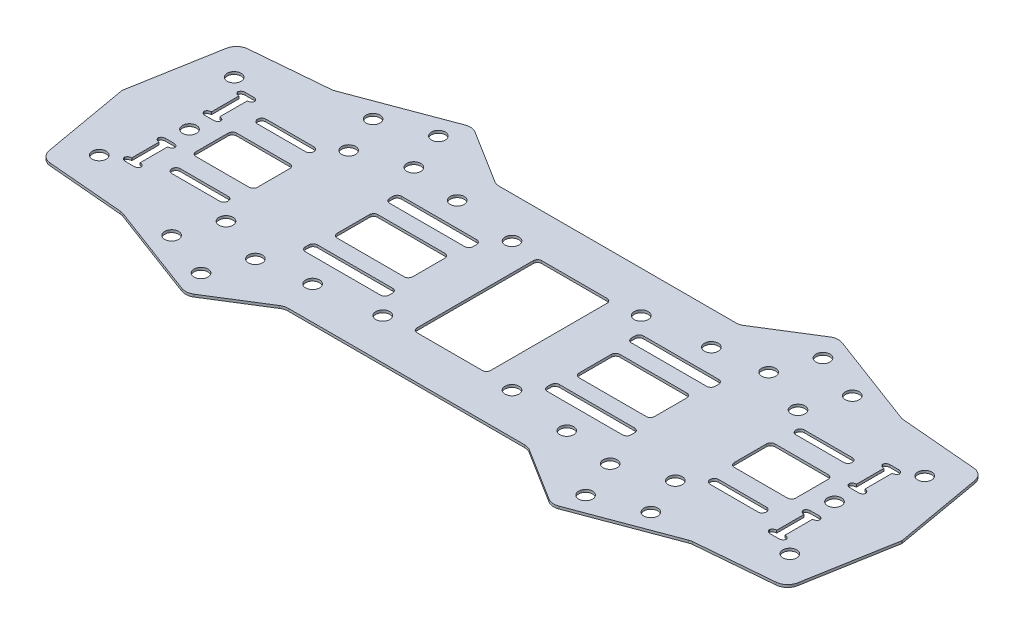
from build123d import *
from build123d.topology import SkipClean

# Parameters (mm, degrees)
BOSS_EXTRUDE1_DEPTH  = 0.6
CUT_EXTRUDE1_REACH   = 100.472
SKETCH2_R            = 1.65
CUT_EXTRUDE2_REACH   = 100.472
SKETCH3_W            = 8.75
SKETCH3_H            = 14.8
SKETCH3_W_2          = 17.9
SKETCH3_H_2          = 4.825
SKETCH3_W_3          = 14.6
SKETCH3_W_4          = 19.85
SKETCH3_H_3          = 2.85
SKETCH3_W_5          = 13.35
SKETCH3_H_4          = 2
FILLET1_R            = 1
FILLET1_OF_MIRROR1_R = 1
MIRROR2_OUTLINE_R    = 1.65
MIRROR2_DEPTH        = 0.6


# Read off the part's stored shape, not the designer's step: Mirror2
with BuildPart() as part:
    # Sketch1 → Boss-Extrude1 (new body)
    with BuildSketch(Plane(origin=(0, 0, 0), x_dir=(1, 0, 0), z_dir=(0, 1, 0))):
        with BuildLine():
            Line((0, 25.05), (-28.014357522, 25.05))
            ThreePointArc((-28.014357522, 25.05), (-28.841630476, 25.166318419), (-29.604752042, 25.506253694))
            Line((-29.604752042, 25.506253694), (-42.084431009, 33.308766465))
            ThreePointArc((-42.084431009, 33.308766465), (-43.375, 33.75), (-44.727541441, 33.574253009))
            Line((-44.727541441, 33.574253009), (-67.089543652, 25.194443715))
            ThreePointArc((-67.089543652, 25.194443715), (-67.481193837, 25.077417503), (-67.885116707, 25.014717291))
            Line((-67.885116707, 25.014717291), (-86.101034423, 23.447585491))
            ThreePointArc((-86.101034423, 23.447585491), (-87.868937695, 22.672037198), (-88.798256509, 20.979901364))
            Line((-88.798256509, 20.979901364), (-92.5, 0))
            Line((-92.5, 0), (0, 0))
            Line((0, 0), (0, 25.05))
        make_face()
    boss_extrude1 = extrude(amount=BOSS_EXTRUDE1_DEPTH)

    # Sketch2 → Cut-Extrude1 (cut, up to next)
    with BuildSketch(Plane(origin=(0, 0.6, 0), x_dir=(1, 0, 0), z_dir=(0, 1, 0)), mode=Mode.PRIVATE) as cut_extrude1_sk1:
        with Locations(Location((-15.325, 15.325, 0), (0, 0, 270))):
            Circle(SKETCH2_R)
    cut_extrude1_tool1 = extrude(cut_extrude1_sk1.sketch, amount=-CUT_EXTRUDE1_REACH, mode=Mode.PRIVATE) & part.part
    # Sketch2 → Cut-Extrude1 (cut, up to next)
    with BuildSketch(Plane(origin=(0, 0.6, 0), x_dir=(1, 0, 0), z_dir=(0, 1, 0)), mode=Mode.PRIVATE) as cut_extrude1_sk2:
        with Locations(Location((-30.15, 17.15, 0), (0, 0, 270))):
            Circle(SKETCH2_R)
    cut_extrude1_tool2 = extrude(cut_extrude1_sk2.sketch, amount=-CUT_EXTRUDE1_REACH, mode=Mode.PRIVATE) & part.part
    # Sketch2 → Cut-Extrude1 (cut, up to next)
    with BuildSketch(Plane(origin=(0, 0.6, 0), x_dir=(1, 0, 0), z_dir=(0, 1, 0)), mode=Mode.PRIVATE) as cut_extrude1_sk3:
        with Locations(Location((-42.075, 18.8, 0), (0, 0, 270))):
            Circle(SKETCH2_R)
    cut_extrude1_tool3 = extrude(cut_extrude1_sk3.sketch, amount=-CUT_EXTRUDE1_REACH, mode=Mode.PRIVATE) & part.part
    # Sketch2 → Cut-Extrude1 (cut, up to next)
    with BuildSketch(Plane(origin=(0, 0.6, 0), x_dir=(1, 0, 0), z_dir=(0, 1, 0)), mode=Mode.PRIVATE) as cut_extrude1_sk4:
        with Locations(Location((-45.616666667, 28.151823203, 0), (0, 0, 270))):
            Circle(SKETCH2_R)
    cut_extrude1_tool4 = extrude(cut_extrude1_sk4.sketch, amount=-CUT_EXTRUDE1_REACH, mode=Mode.PRIVATE) & part.part
    # Sketch2 → Cut-Extrude1 (cut, up to next)
    with BuildSketch(Plane(origin=(0, 0.6, 0), x_dir=(1, 0, 0), z_dir=(0, 1, 0)), mode=Mode.PRIVATE) as cut_extrude1_sk5:
        with Locations(Location((-53.297187844, 14.55, 0), (0, 0, 270))):
            Circle(SKETCH2_R)
    cut_extrude1_tool5 = extrude(cut_extrude1_sk5.sketch, amount=-CUT_EXTRUDE1_REACH, mode=Mode.PRIVATE) & part.part
    # Sketch2 → Cut-Extrude1 (cut, up to next)
    with BuildSketch(Plane(origin=(0, 0.6, 0), x_dir=(1, 0, 0), z_dir=(0, 1, 0)), mode=Mode.PRIVATE) as cut_extrude1_sk6:
        with Locations(Location((-56.83885451, 23.901823203, 0), (0, 0, 270))):
            Circle(SKETCH2_R)
    cut_extrude1_tool6 = extrude(cut_extrude1_sk6.sketch, amount=-CUT_EXTRUDE1_REACH, mode=Mode.PRIVATE) & part.part
    # Sketch2 → Cut-Extrude1 (cut, up to next)
    with BuildSketch(Plane(origin=(0, 0.6, 0), x_dir=(1, 0, 0), z_dir=(0, 1, 0)), mode=Mode.PRIVATE) as cut_extrude1_sk7:
        with Locations(Location((-81.910471472, 16, 0), (0, 0, 270))):
            Circle(SKETCH2_R)
    cut_extrude1_tool7 = extrude(cut_extrude1_sk7.sketch, amount=-CUT_EXTRUDE1_REACH, mode=Mode.PRIVATE) & part.part
    # Sketch2 → Cut-Extrude1 (cut, up to next)
    with BuildSketch(Plane(origin=(0, 0.6, 0), x_dir=(1, 0, 0), z_dir=(0, 1, 0)), mode=Mode.PRIVATE) as cut_extrude1_sk8:
        with Locations((-76.5, 0)):
            Circle(SKETCH2_R)
    cut_extrude1_tool8 = extrude(cut_extrude1_sk8.sketch, amount=-CUT_EXTRUDE1_REACH, mode=Mode.PRIVATE) & part.part
    cut_extrude1_1 = cut_extrude1_tool1.solids().sort_by_distance((-15.325, 0.6, -15.325))[0]
    add(cut_extrude1_1, mode=Mode.SUBTRACT)
    cut_extrude1_2 = cut_extrude1_tool2.solids().sort_by_distance((-30.15, 0.6, -17.15))[0]
    add(cut_extrude1_2, mode=Mode.SUBTRACT)
    cut_extrude1_3 = cut_extrude1_tool3.solids().sort_by_distance((-42.075, 0.6, -18.8))[0]
    add(cut_extrude1_3, mode=Mode.SUBTRACT)
    cut_extrude1_4 = cut_extrude1_tool4.solids().sort_by_distance((-45.616667, 0.6, -28.151823))[0]
    add(cut_extrude1_4, mode=Mode.SUBTRACT)
    cut_extrude1_5 = cut_extrude1_tool5.solids().sort_by_distance((-53.297188, 0.6, -14.55))[0]
    add(cut_extrude1_5, mode=Mode.SUBTRACT)
    cut_extrude1_6 = cut_extrude1_tool6.solids().sort_by_distance((-56.838855, 0.6, -23.901823))[0]
    add(cut_extrude1_6, mode=Mode.SUBTRACT)
    cut_extrude1_7 = cut_extrude1_tool7.solids().sort_by_distance((-81.910471, 0.6, -16))[0]
    add(cut_extrude1_7, mode=Mode.SUBTRACT)
    cut_extrude1_8 = cut_extrude1_tool8.solids().sort_by_distance((-76.5, 0.6, 0))[0]
    add(cut_extrude1_8, mode=Mode.SUBTRACT)
    cut_extrude1 = cut_extrude1_1 + cut_extrude1_2 + cut_extrude1_3 + cut_extrude1_4 + cut_extrude1_5 + cut_extrude1_6 + cut_extrude1_7 + cut_extrude1_8  # Cut-Extrude1 as one shape, for the pattern or mirror that repeats it

    # Sketch3 → Cut-Extrude2 (cut, up to next)
    with BuildSketch(Plane(origin=(0, 0.6, 0), x_dir=(1, 0, 0), z_dir=(0, 1, 0)), mode=Mode.PRIVATE) as cut_extrude2_sk1:
        with Locations((-4.375, 7.4)):
            Rectangle(SKETCH3_W, SKETCH3_H)
    cut_extrude2_tool1 = extrude(cut_extrude2_sk1.sketch, amount=-CUT_EXTRUDE2_REACH, mode=Mode.PRIVATE) & part.part
    # Sketch3 → Cut-Extrude2 (cut, up to next)
    with BuildSketch(Plane(origin=(0, 0.6, 0), x_dir=(1, 0, 0), z_dir=(0, 1, 0)), mode=Mode.PRIVATE) as cut_extrude2_sk2:
        with Locations((-28.7, 2.4125)):
            Rectangle(SKETCH3_W_2, SKETCH3_H_2)
    cut_extrude2_tool2 = extrude(cut_extrude2_sk2.sketch, amount=-CUT_EXTRUDE2_REACH, mode=Mode.PRIVATE) & part.part
    # Sketch3 → Cut-Extrude2 (cut, up to next)
    with BuildSketch(Plane(origin=(0, 0.6, 0), x_dir=(1, 0, 0), z_dir=(0, 1, 0)), mode=Mode.PRIVATE) as cut_extrude2_sk3:
        with Locations((-63.85, 2.4125)):
            Rectangle(SKETCH3_W_3, SKETCH3_H_2)
    cut_extrude2_tool3 = extrude(cut_extrude2_sk3.sketch, amount=-CUT_EXTRUDE2_REACH, mode=Mode.PRIVATE) & part.part
    # Sketch3 → Cut-Extrude2 (cut, up to next)
    with BuildSketch(Plane(origin=(0, 0.6, 0), x_dir=(1, 0, 0), z_dir=(0, 1, 0)), mode=Mode.PRIVATE) as cut_extrude2_sk4:
        with Locations((-28.7, 9.975)):
            Rectangle(SKETCH3_W_4, SKETCH3_H_3)
    cut_extrude2_tool4 = extrude(cut_extrude2_sk4.sketch, amount=-CUT_EXTRUDE2_REACH, mode=Mode.PRIVATE) & part.part
    # Sketch3 → Cut-Extrude2 (cut, up to next)
    with BuildSketch(Plane(origin=(0, 0.6, 0), x_dir=(1, 0, 0), z_dir=(0, 1, 0)), mode=Mode.PRIVATE) as cut_extrude2_sk5:
        with Locations((-63.85, 10.175)):
            Rectangle(SKETCH3_W_5, SKETCH3_H_4)
    cut_extrude2_tool5 = extrude(cut_extrude2_sk5.sketch, amount=-CUT_EXTRUDE2_REACH, mode=Mode.PRIVATE) & part.part
    # Sketch3 → Cut-Extrude2 (cut, up to next)
    with BuildSketch(Plane(origin=(0, 0.6, 0), x_dir=(1, 0, 0), z_dir=(0, 1, 0)), mode=Mode.PRIVATE) as cut_extrude2_sk6:
        Polygon((-78.55, 6.2), (-78.55, 4.7), (-74.45, 4.7), (-74.45, 6.2), (-75.5, 6.2), (-75.5, 12.7), (-74.45, 12.7), (-74.45, 14.2), (-78.55, 14.2), (-78.55, 12.7), (-77.5, 12.7), (-77.5, 6.2), align=None)
    cut_extrude2_tool6 = extrude(cut_extrude2_sk6.sketch, amount=-CUT_EXTRUDE2_REACH, mode=Mode.PRIVATE) & part.part
    cut_extrude2_1 = cut_extrude2_tool1.solids().sort_by_distance((-4.375, 0.6, -7.4))[0]
    add(cut_extrude2_1, mode=Mode.SUBTRACT)
    cut_extrude2_2 = cut_extrude2_tool2.solids().sort_by_distance((-28.7, 0.6, -2.4125))[0]
    add(cut_extrude2_2, mode=Mode.SUBTRACT)
    cut_extrude2_3 = cut_extrude2_tool3.solids().sort_by_distance((-63.85, 0.6, -2.4125))[0]
    add(cut_extrude2_3, mode=Mode.SUBTRACT)
    cut_extrude2_4 = cut_extrude2_tool4.solids().sort_by_distance((-28.7, 0.6, -9.975))[0]
    add(cut_extrude2_4, mode=Mode.SUBTRACT)
    cut_extrude2_5 = cut_extrude2_tool5.solids().sort_by_distance((-63.85, 0.6, -10.175))[0]
    add(cut_extrude2_5, mode=Mode.SUBTRACT)
    cut_extrude2_6 = cut_extrude2_tool6.solids().sort_by_distance((-76.5, 0.6, -9.45))[0]
    add(cut_extrude2_6, mode=Mode.SUBTRACT)
    cut_extrude2 = cut_extrude2_1 + cut_extrude2_2 + cut_extrude2_3 + cut_extrude2_4 + cut_extrude2_5 + cut_extrude2_6  # Cut-Extrude2 as one shape, for the pattern or mirror that repeats it

    # Fillet1
    # the kernel refuses this fillet: 1 mm, written as the material it adds along each edge
    with BuildSketch(Plane(origin=(-38.625, 0.6, -8.55), x_dir=(0, 0, -1), z_dir=(0, -1, 0)), Plane(origin=(-70.525, 0.6, -9.175), x_dir=(0, 0, -1), z_dir=(0, -1, 0)), Plane(origin=(-78.55, 0.6, -12.7), x_dir=(0, 0, -1), z_dir=(0, -1, 0)), Plane(origin=(-74.45, 0.6, -12.7), x_dir=(-1, 0, 0), z_dir=(0, -1, 0)), Plane(origin=(-57.175, 0.6, -9.175), x_dir=(-1, 0, 0), z_dir=(0, -1, 0)), Plane(origin=(-18.775, 0.6, -8.55), x_dir=(-1, 0, 0), z_dir=(0, -1, 0)), Plane(origin=(-8.75, 0.6, -14.8), x_dir=(1, 0, 0), z_dir=(0, -1, 0)), Plane(origin=(-37.65, 0.6, -4.825), x_dir=(1, 0, 0), z_dir=(0, -1, 0)), Plane(origin=(-19.75, 0.6, -4.825), x_dir=(0, 0, 1), z_dir=(0, -1, 0)), Plane(origin=(-18.775, 0.6, -11.4), x_dir=(0, 0, 1), z_dir=(0, -1, 0)), Plane(origin=(-56.55, 0.6, -4.825), x_dir=(0, 0, 1), z_dir=(0, -1, 0)), Plane(origin=(-57.175, 0.6, -11.175), x_dir=(0, 0, 1), z_dir=(0, -1, 0)), Plane(origin=(-74.45, 0.6, -14.2), x_dir=(0, 0, 1), z_dir=(0, -1, 0)), Plane(origin=(-78.55, 0.6, -14.2), x_dir=(1, 0, 0), z_dir=(0, -1, 0)), Plane(origin=(-71.15, 0.6, -4.825), x_dir=(1, 0, 0), z_dir=(0, -1, 0)), Plane(origin=(-74.45, 0.6, -4.7), x_dir=(-1, 0, 0), z_dir=(0, -1, 0)), Plane(origin=(-74.45, 0.6, -6.2), x_dir=(0, 0, 1), z_dir=(0, -1, 0)), Plane(origin=(-78.55, 0.6, -6.2), x_dir=(1, 0, 0), z_dir=(0, -1, 0))) as fillet1_piece_1:
        with BuildLine():
            CenterArc((FILLET1_R, FILLET1_R), FILLET1_R, 180, 90)
            Line((0, FILLET1_R), (0, 0))
            Line((0, 0), (FILLET1_R, 0))
        make_face()
    extrude(amount=0.6)
    with BuildSketch(Plane(origin=(-70.525, 0.6, -11.175), x_dir=(0, 0, 1), z_dir=(0, -1, 0)), Plane(origin=(-38.625, 0.6, -11.4), x_dir=(0, 0, 1), z_dir=(0, -1, 0)), Plane(origin=(-78.55, 0.6, -4.7), x_dir=(1, 0, 0), z_dir=(0, -1, 0))) as fillet1_piece_2:
        with BuildLine():
            CenterArc((FILLET1_R, -FILLET1_R), FILLET1_R, 90, 90)
            Line((0, -FILLET1_R), (0, 0))
            Line((0, 0), (FILLET1_R, 0))
        make_face()
    extrude(amount=0.6)

    # Mirror1: Boss-Extrude1, Cut-Extrude1, Cut-Extrude2 across plane
    add(boss_extrude1.mirror(Plane(origin=(0, 0, 0), x_dir=(0, 0, 1), z_dir=(1, 0, 0))))
    add(cut_extrude1.mirror(Plane(origin=(0, 0, 0), x_dir=(0, 0, 1), z_dir=(1, 0, 0))), mode=Mode.SUBTRACT)
    add(cut_extrude2.mirror(Plane(origin=(0, 0, 0), x_dir=(0, 0, 1), z_dir=(1, 0, 0))), mode=Mode.SUBTRACT)

    # Fillet1 of Mirror1
    # the kernel refuses this fillet: 1 mm, written as the material it adds along each edge
    with BuildSketch(Plane(origin=(38.625, 0.6, -8.55), x_dir=(-1, 0, 0), z_dir=(0, -1, 0)), Plane(origin=(70.525, 0.6, -9.175), x_dir=(-1, 0, 0), z_dir=(0, -1, 0)), Plane(origin=(78.55, 0.6, -12.7), x_dir=(-1, 0, 0), z_dir=(0, -1, 0)), Plane(origin=(74.45, 0.6, -12.7), x_dir=(0, 0, -1), z_dir=(0, -1, 0)), Plane(origin=(57.175, 0.6, -9.175), x_dir=(0, 0, -1), z_dir=(0, -1, 0)), Plane(origin=(18.775, 0.6, -8.55), x_dir=(0, 0, -1), z_dir=(0, -1, 0)), Plane(origin=(8.75, 0.6, -14.8), x_dir=(0, 0, 1), z_dir=(0, -1, 0)), Plane(origin=(37.65, 0.6, -4.825), x_dir=(0, 0, 1), z_dir=(0, -1, 0)), Plane(origin=(19.75, 0.6, -4.825), x_dir=(1, 0, 0), z_dir=(0, -1, 0)), Plane(origin=(56.55, 0.6, -4.825), x_dir=(1, 0, 0), z_dir=(0, -1, 0)), Plane(origin=(74.45, 0.6, -14.2), x_dir=(1, 0, 0), z_dir=(0, -1, 0)), Plane(origin=(78.55, 0.6, -14.2), x_dir=(0, 0, 1), z_dir=(0, -1, 0)), Plane(origin=(70.525, 0.6, -11.175), x_dir=(0, 0, 1), z_dir=(0, -1, 0)), Plane(origin=(38.625, 0.6, -11.4), x_dir=(0, 0, 1), z_dir=(0, -1, 0)), Plane(origin=(71.15, 0.6, -4.825), x_dir=(0, 0, 1), z_dir=(0, -1, 0)), Plane(origin=(74.45, 0.6, -4.7), x_dir=(0, 0, -1), z_dir=(0, -1, 0)), Plane(origin=(74.45, 0.6, -6.2), x_dir=(1, 0, 0), z_dir=(0, -1, 0)), Plane(origin=(78.55, 0.6, -4.7), x_dir=(-1, 0, 0), z_dir=(0, -1, 0))) as fillet1_of_mirror1_piece_1:
        with BuildLine():
            CenterArc((FILLET1_OF_MIRROR1_R, FILLET1_OF_MIRROR1_R), FILLET1_OF_MIRROR1_R, 180, 90)
            Line((0, FILLET1_OF_MIRROR1_R), (0, 0))
            Line((0, 0), (FILLET1_OF_MIRROR1_R, 0))
        make_face()
    extrude(amount=0.6)
    with BuildSketch(Plane(origin=(18.775, 0.6, -11.4), x_dir=(0, 0, 1), z_dir=(0, -1, 0)), Plane(origin=(57.175, 0.6, -11.175), x_dir=(0, 0, 1), z_dir=(0, -1, 0)), Plane(origin=(78.55, 0.6, -6.2), x_dir=(-1, 0, 0), z_dir=(0, -1, 0))) as fillet1_of_mirror1_piece_2:
        with BuildLine():
            CenterArc((FILLET1_OF_MIRROR1_R, -FILLET1_OF_MIRROR1_R), FILLET1_OF_MIRROR1_R, 90, 90)
            Line((0, -FILLET1_OF_MIRROR1_R), (0, 0))
            Line((0, 0), (FILLET1_OF_MIRROR1_R, 0))
        make_face()
    extrude(amount=0.6)

    # Mirror2 outline → Mirror2 (add)
    with SkipClean():  # the faces are left unmerged after this step: merging them gives an invalid solid
        with BuildSketch(Plane(origin=(0, 0, 0), x_dir=(1, 0, 0), z_dir=(0, 1, 0))):
            with BuildLine():
                Line((-71.15, 0), (-74.85, 0))
                ThreePointArc((-74.85, 0), (-76.5, -1.65), (-78.15, 0))
                Line((-78.15, 0), (-92.5, 0))
                Line((-92.5, 0), (-88.798256509, -20.979901364))
                ThreePointArc((-88.798256509, -20.979901364), (-87.868937695, -22.672037198), (-86.101034423, -23.447585491))
                Line((-86.101034423, -23.447585491), (-67.885116707, -25.014717291))
                ThreePointArc((-67.885116707, -25.014717291), (-67.481193837, -25.077417503), (-67.089543652, -25.194443715))
                Line((-67.089543652, -25.194443715), (-44.727541441, -33.574253009))
                ThreePointArc((-44.727541441, -33.574253009), (-43.375, -33.75), (-42.084431009, -33.308766465))
                Line((-42.084431009, -33.308766465), (-29.604752042, -25.506253694))
                ThreePointArc((-29.604752042, -25.506253694), (-28.841630476, -25.166318419), (-28.014357522, -25.05))
                Line((-28.014357522, -25.05), (28.014357522, -25.05))
                ThreePointArc((28.014357522, -25.05), (28.841630476, -25.166318419), (29.604752042, -25.506253694))
                Line((29.604752042, -25.506253694), (42.084431009, -33.308766465))
                ThreePointArc((42.084431009, -33.308766465), (43.375, -33.75), (44.727541441, -33.574253009))
                Line((44.727541441, -33.574253009), (67.089543652, -25.194443715))
                ThreePointArc((67.089543652, -25.194443715), (67.481193837, -25.077417503), (67.885116707, -25.014717291))
                Line((67.885116707, -25.014717291), (86.101034423, -23.447585491))
                ThreePointArc((86.101034423, -23.447585491), (87.868937695, -22.672037198), (88.798256509, -20.979901364))
                Line((88.798256509, -20.979901364), (92.5, 0))
                Line((92.5, 0), (78.15, 0))
                ThreePointArc((78.15, 0), (76.5, -1.65), (74.85, 0))
                Line((74.85, 0), (71.15, 0))
                Line((71.15, 0), (71.15, -3.825))
                ThreePointArc((71.15, -3.825), (70.857106781, -4.532106781), (70.15, -4.825))
                Line((70.15, -4.825), (57.55, -4.825))
                ThreePointArc((57.55, -4.825), (56.842893219, -4.532106781), (56.55, -3.825))
                Line((56.55, -3.825), (56.55, 0))
                Line((56.55, 0), (37.65, 0))
                Line((37.65, 0), (37.65, -3.825))
                ThreePointArc((37.65, -3.825), (37.357106781, -4.532106781), (36.65, -4.825))
                Line((36.65, -4.825), (20.75, -4.825))
                ThreePointArc((20.75, -4.825), (20.042893219, -4.532106781), (19.75, -3.825))
                Line((19.75, -3.825), (19.75, 0))
                Line((19.75, 0), (8.75, 0))
                Line((8.75, 0), (8.75, -13.8))
                ThreePointArc((8.75, -13.8), (8.457106781, -14.507106781), (7.75, -14.8))
                Line((7.75, -14.8), (-7.75, -14.8))
                ThreePointArc((-7.75, -14.8), (-8.457106781, -14.507106781), (-8.75, -13.8))
                Line((-8.75, -13.8), (-8.75, 0))
                Line((-8.75, 0), (-19.75, 0))
                Line((-19.75, 0), (-19.75, -3.825))
                ThreePointArc((-19.75, -3.825), (-20.042893219, -4.532106781), (-20.75, -4.825))
                Line((-20.75, -4.825), (-36.65, -4.825))
                ThreePointArc((-36.65, -4.825), (-37.357106781, -4.532106781), (-37.65, -3.825))
                Line((-37.65, -3.825), (-37.65, 0))
                Line((-37.65, 0), (-56.55, 0))
                Line((-56.55, 0), (-56.55, -3.825))
                ThreePointArc((-56.55, -3.825), (-56.842893219, -4.532106781), (-57.55, -4.825))
                Line((-57.55, -4.825), (-70.15, -4.825))
                ThreePointArc((-70.15, -4.825), (-70.857106781, -4.532106781), (-71.15, -3.825))
                Line((-71.15, -3.825), (-71.15, 0))
            make_face()
            with Locations((-45.616666667, -28.151823203)):
                Circle(MIRROR2_OUTLINE_R, mode=Mode.SUBTRACT)
            with Locations((-56.83885451, -23.901823203)):
                Circle(MIRROR2_OUTLINE_R, mode=Mode.SUBTRACT)
            with Locations((-42.075, -18.8)):
                Circle(MIRROR2_OUTLINE_R, mode=Mode.SUBTRACT)
            with Locations((-30.15, -17.15)):
                Circle(MIRROR2_OUTLINE_R, mode=Mode.SUBTRACT)
            with Locations((45.616666667, -28.151823203)):
                Circle(MIRROR2_OUTLINE_R, mode=Mode.SUBTRACT)
            with Locations((42.075, -18.8)):
                Circle(MIRROR2_OUTLINE_R, mode=Mode.SUBTRACT)
            with Locations((30.15, -17.15)):
                Circle(MIRROR2_OUTLINE_R, mode=Mode.SUBTRACT)
            with Locations((56.83885451, -23.901823203)):
                Circle(MIRROR2_OUTLINE_R, mode=Mode.SUBTRACT)
            with Locations((-81.910471472, -16)):
                Circle(MIRROR2_OUTLINE_R, mode=Mode.SUBTRACT)
            with Locations((-53.297187844, -14.55)):
                Circle(MIRROR2_OUTLINE_R, mode=Mode.SUBTRACT)
            with BuildLine():
                Line((-77.5, -12.7), (-77.5, -6.2))
                Line((-77.5, -6.2), (-77.55, -6.2))
                ThreePointArc((-77.55, -6.2), (-78.162372436, -5.990569415), (-78.518245837, -5.45))
                ThreePointArc((-78.518245837, -5.45), (-78.162372436, -4.909430585), (-77.55, -4.7))
                Line((-77.55, -4.7), (-75.45, -4.7))
                ThreePointArc((-75.45, -4.7), (-74.837627564, -4.909430585), (-74.481754163, -5.45))
                ThreePointArc((-74.481754163, -5.45), (-74.837627564, -5.990569415), (-75.45, -6.2))
                Line((-75.45, -6.2), (-75.5, -6.2))
                Line((-75.5, -6.2), (-75.5, -12.7))
                Line((-75.5, -12.7), (-75.45, -12.7))
                ThreePointArc((-75.45, -12.7), (-74.837627564, -12.909430585), (-74.481754163, -13.45))
                ThreePointArc((-74.481754163, -13.45), (-74.837627564, -13.990569415), (-75.45, -14.2))
                Line((-75.45, -14.2), (-77.55, -14.2))
                ThreePointArc((-77.55, -14.2), (-78.162372436, -13.990569415), (-78.518245837, -13.45))
                ThreePointArc((-78.518245837, -13.45), (-78.162372436, -12.909430585), (-77.55, -12.7))
                Line((-77.55, -12.7), (-77.5, -12.7))
            make_face(mode=Mode.SUBTRACT)
            with BuildLine():
                ThreePointArc((-70.525, -10.175), (-70.232106781, -9.467893219), (-69.525, -9.175))
                Line((-69.525, -9.175), (-58.175, -9.175))
                ThreePointArc((-58.175, -9.175), (-57.467893219, -9.467893219), (-57.175, -10.175))
                ThreePointArc((-57.175, -10.175), (-57.467893219, -10.882106781), (-58.175, -11.175))
                Line((-58.175, -11.175), (-69.525, -11.175))
                ThreePointArc((-69.525, -11.175), (-70.232106781, -10.882106781), (-70.525, -10.175))
            make_face(mode=Mode.SUBTRACT)
            with Locations((-15.325, -15.325)):
                Circle(MIRROR2_OUTLINE_R, mode=Mode.SUBTRACT)
            with BuildLine():
                Line((-18.775, -9.55), (-18.775, -10.4))
                ThreePointArc((-18.775, -10.4), (-19.067893219, -11.107106781), (-19.775, -11.4))
                Line((-19.775, -11.4), (-37.625, -11.4))
                ThreePointArc((-37.625, -11.4), (-38.332106781, -11.107106781), (-38.625, -10.4))
                Line((-38.625, -10.4), (-38.625, -9.55))
                ThreePointArc((-38.625, -9.55), (-38.332106781, -8.842893219), (-37.625, -8.55))
                Line((-37.625, -8.55), (-19.775, -8.55))
                ThreePointArc((-19.775, -8.55), (-19.067893219, -8.842893219), (-18.775, -9.55))
            make_face(mode=Mode.SUBTRACT)
            with Locations((15.325, -15.325)):
                Circle(MIRROR2_OUTLINE_R, mode=Mode.SUBTRACT)
            with BuildLine():
                ThreePointArc((19.775, -11.4), (19.067893219, -11.107106781), (18.775, -10.4))
                Line((18.775, -10.4), (18.775, -9.55))
                ThreePointArc((18.775, -9.55), (19.067893219, -8.842893219), (19.775, -8.55))
                Line((19.775, -8.55), (37.625, -8.55))
                ThreePointArc((37.625, -8.55), (38.332106781, -8.842893219), (38.625, -9.55))
                Line((38.625, -9.55), (38.625, -10.4))
                ThreePointArc((38.625, -10.4), (38.332106781, -11.107106781), (37.625, -11.4))
                Line((37.625, -11.4), (19.775, -11.4))
            make_face(mode=Mode.SUBTRACT)
            with Locations((53.297187844, -14.55)):
                Circle(MIRROR2_OUTLINE_R, mode=Mode.SUBTRACT)
            with Locations((81.910471472, -16)):
                Circle(MIRROR2_OUTLINE_R, mode=Mode.SUBTRACT)
            with BuildLine():
                Line((58.175, -9.175), (69.525, -9.175))
                ThreePointArc((69.525, -9.175), (70.232106781, -9.467893219), (70.525, -10.175))
                ThreePointArc((70.525, -10.175), (70.232106781, -10.882106781), (69.525, -11.175))
                Line((69.525, -11.175), (58.175, -11.175))
                ThreePointArc((58.175, -11.175), (57.467893219, -10.882106781), (57.175, -10.175))
                ThreePointArc((57.175, -10.175), (57.467893219, -9.467893219), (58.175, -9.175))
            make_face(mode=Mode.SUBTRACT)
            with BuildLine():
                Line((77.55, -6.2), (77.5, -6.2))
                Line((77.5, -6.2), (77.5, -12.7))
                Line((77.5, -12.7), (77.55, -12.7))
                ThreePointArc((77.55, -12.7), (78.162372436, -12.909430585), (78.518245837, -13.45))
                ThreePointArc((78.518245837, -13.45), (78.162372436, -13.990569415), (77.55, -14.2))
                Line((77.55, -14.2), (75.45, -14.2))
                ThreePointArc((75.45, -14.2), (74.837627564, -13.990569415), (74.481754163, -13.45))
                ThreePointArc((74.481754163, -13.45), (74.837627564, -12.909430585), (75.45, -12.7))
                Line((75.45, -12.7), (75.5, -12.7))
                Line((75.5, -12.7), (75.5, -6.2))
                Line((75.5, -6.2), (75.45, -6.2))
                ThreePointArc((75.45, -6.2), (74.837627564, -5.990569415), (74.481754163, -5.45))
                ThreePointArc((74.481754163, -5.45), (74.837627564, -4.909430585), (75.45, -4.7))
                Line((75.45, -4.7), (77.55, -4.7))
                ThreePointArc((77.55, -4.7), (78.162372436, -4.909430585), (78.518245837, -5.45))
                ThreePointArc((78.518245837, -5.45), (78.162372436, -5.990569415), (77.55, -6.2))
            make_face(mode=Mode.SUBTRACT)
        extrude(amount=MIRROR2_DEPTH)
    add(part.part.scale(1), mode=Mode.REPLACE)  # the faces are merged on a copy


solid = part.part
